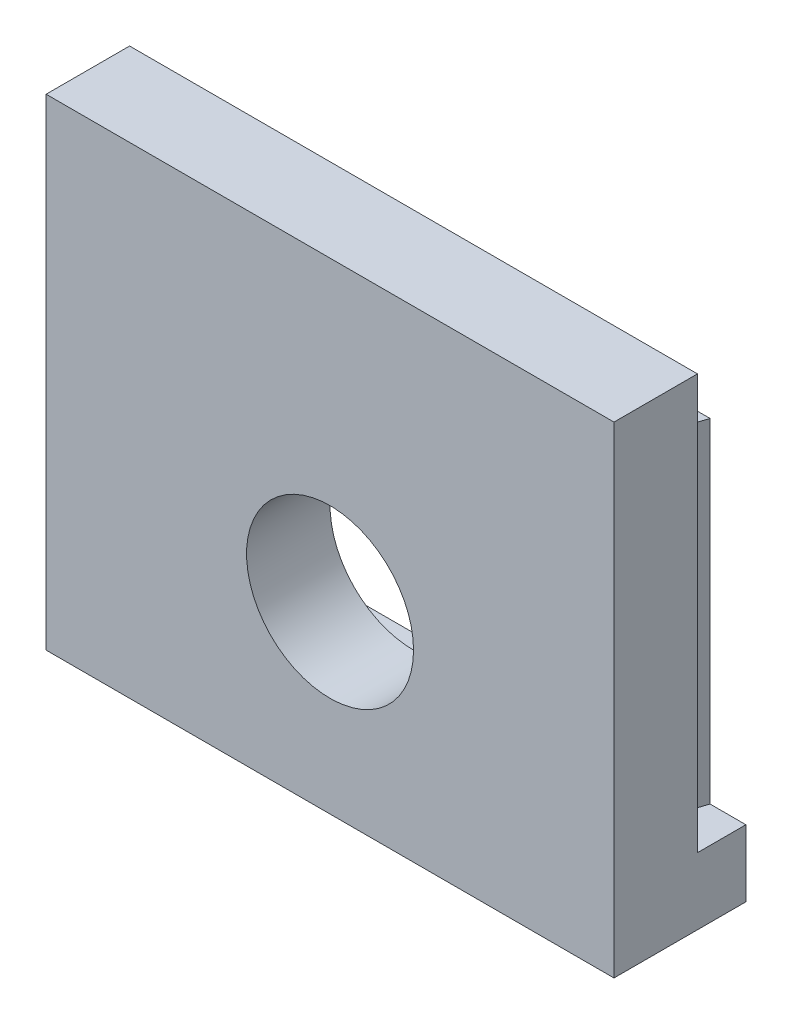
from build123d import *
from OCP.BRepFilletAPI import BRepFilletAPI_MakeChamfer

# Parameters (mm, degrees)
SKETCH_1_R          = 5
EXTRUDE_1_DEPTH     = 5
EXTRUDE_2_REACH     = 42.012
EXTRUDE_3_DEPTH     = 55
EXTRUDE_4_DEPTH     = 20
FILLET_1_R          = 10
CHAMFER_1_SIZE      = 1
CHAMFER_1_SIZE2     = 1.741048535
CHAMFER_1_SIZE2_2   = 3.661578825
CHAMFER_1_SIZE2_3   = 2.732050808
CUT_EXTRUDE_1_REACH = 86.876
SKETCH_5_R          = 1.65
SKETCH_6_R          = 54.70604167
CUT_EXTRUDE_2_DEPTH = 66.501221402
SKETCH_7_W          = 77.77608505
SKETCH_7_H          = 88.124851988
SKETCH_7_W_2        = 34.010032192
SKETCH_7_H_2        = 31.175862843
CUT_EXTRUDE_3_DEPTH = 41.477277576


with BuildPart() as part:
    # 草图1 → 凸台-拉伸1 (new body)
    with BuildSketch(Plane.XY):
        Polygon((-20, 26), (20, 26), (30, 0), (20, -26), (-20, -26), (-30, 0), align=None)
        with Locations((0, -15)):
            Circle(SKETCH_1_R, mode=Mode.SUBTRACT)
    extrude(amount=-EXTRUDE_1_DEPTH)

    # 凸台-拉伸2: up to this plane
    extrude_2_end = Plane(origin=(0, 24.665063509, -42.72114317), z_dir=(0, 0.499999999999998, -0.8660254037844398))
    # 草图2 → 凸台-拉伸2 (add, up to the surface)
    with BuildSketch(Plane(origin=(0, 0, -5), x_dir=(-1, 0, 0), z_dir=(0, 0, -1)), mode=Mode.PRIVATE) as extrude_2_sk1:
        Polygon((-20, 26), (20, 26), (21.923076923, 21), (-21.923076923, 21), align=None)
    extrude_2_tool1 = split(extrude(extrude_2_sk1.sketch, amount=EXTRUDE_2_REACH, mode=Mode.PRIVATE), bisect_by=extrude_2_end, keep=Keep.BOTH, mode=Mode.PRIVATE)
    add(extrude_2_tool1.solids().sort_by_distance((0, 23.461774, -5))[0])

    # 草图3 → 凸台-拉伸3 (add)
    with BuildSketch(Plane(origin=(0, 0, -5), x_dir=(-1, 0, 0), z_dir=(0, 0, -1))):
        Polygon((23.846153846, -16), (20, -26), (-20, -26), (-23.846153846, -16), (-19.560495915, -16), (-17.252803607, -22), (17.252803607, -22), (19.560495915, -16), align=None)
    extrude(amount=EXTRUDE_3_DEPTH)

    # 草图4 → 凸台-拉伸4 (add)
    with BuildSketch(Plane(origin=(0, -2, 0), x_dir=(1, 0, 0), z_dir=(0, 1, 0))):
        Polygon((11.105409255, 5), (10.138742589, 7.9), (14.861257411, 7.9), (13.894590745, 5), align=None)
        Polygon((-11.105409255, 5), (-13.894590745, 5), (-14.861257411, 7.9), (-10.138742589, 7.9), align=None)
    extrude(amount=-EXTRUDE_4_DEPTH)

    # 圆角1
    fillet_1_edges = [part.edges().sort_by_distance(p)[0] for p in [
        (-21.70332488, -16, -60),
        (21.70332488, -16, -5),
        (-21.70332488, -16, -5),
        (-20.961538462, 23.5, -43.393792901),
        (20.961538462, 23.5, -43.393792901),
    ]]
    fillet(fillet_1_edges, radius=FILLET_1_R - 0.0001)  # a hair under: the kernel refuses the full size

    # 倒角1: one chamfer whose edges measure the first distance from different faces: ONE call of the kernel's chamfer builder (chamfer() names one face for all edges)
    chamfer_1_edges_1 = [part.edges().sort_by_distance(p)[0] for p in [
        (20, 26, -16.238036635),
    ]]
    chamfer_1_side_1 = [part.faces().sort_by_distance(p)[0] for p in [
        (20.161601575, 25.579835904, -16.238036635),
    ]]
    chamfer_1_edges_2 = [part.edges().sort_by_distance(p)[0] for p in [
        (17.633378474, 26, -39.139308282),
        (-17.633378474, 26, -39.139308282),
    ]]
    chamfer_1_side_2 = [part.faces().sort_by_distance(p)[0] for p in [
        (0, 26, -20.586375743),
    ]]
    chamfer_1_edges_3 = [part.edges().sort_by_distance(p)[0] for p in [
        (0, 26, -41.950417228),
    ]]
    chamfer_1_side_3 = [part.faces().sort_by_distance(p)[0] for p in [
        (0, 26, -20.586375743),
    ]]
    chamfer_1_edges_4 = [part.edges().sort_by_distance(p)[0] for p in [
        (-20, 26, -16.238036635),
    ]]
    chamfer_1_side_4 = [part.faces().sort_by_distance(p)[0] for p in [
        (-21.761475348, 21.420164096, -20.181412308),
    ]]
    chamfer_1 = BRepFilletAPI_MakeChamfer(part.part.solid().wrapped)
    for e in chamfer_1_edges_1:
        chamfer_1.Add(CHAMFER_1_SIZE, CHAMFER_1_SIZE2, e.wrapped, chamfer_1_side_1[0].wrapped)  # the first distance lies on this face
    for e in chamfer_1_edges_2:
        chamfer_1.Add(CHAMFER_1_SIZE, CHAMFER_1_SIZE2_2, e.wrapped, chamfer_1_side_2[0].wrapped)  # the first distance lies on this face
    for e in chamfer_1_edges_3:
        chamfer_1.Add(CHAMFER_1_SIZE, CHAMFER_1_SIZE2_3, e.wrapped, chamfer_1_side_3[0].wrapped)  # the first distance lies on this face
    for e in chamfer_1_edges_4:
        chamfer_1.Add(CHAMFER_1_SIZE, CHAMFER_1_SIZE2, e.wrapped, chamfer_1_side_4[0].wrapped)  # the first distance lies on this face
    add(Compound.cast(chamfer_1.Shape()), mode=Mode.REPLACE)

    # 草图5 → 切除-拉伸1 (cut, up to next)
    with BuildSketch(Plane(origin=(0, 26, 0), x_dir=(1, 0, 0), z_dir=(0, 1, 0)), mode=Mode.PRIVATE) as cut_extrude_1_sk1:
        with Locations((14, 36)):
            Circle(SKETCH_5_R)
    cut_extrude_1_tool1 = extrude(cut_extrude_1_sk1.sketch, amount=-CUT_EXTRUDE_1_REACH, mode=Mode.PRIVATE) & part.part
    # 草图5 → 切除-拉伸1 (cut, up to next)
    with BuildSketch(Plane(origin=(0, 26, 0), x_dir=(1, 0, 0), z_dir=(0, 1, 0)), mode=Mode.PRIVATE) as cut_extrude_1_sk2:
        with Locations((14, 8)):
            Circle(SKETCH_5_R)
    cut_extrude_1_tool2 = extrude(cut_extrude_1_sk2.sketch, amount=-CUT_EXTRUDE_1_REACH, mode=Mode.PRIVATE) & part.part
    # 草图5 → 切除-拉伸1 (cut, up to next)
    with BuildSketch(Plane(origin=(0, 26, 0), x_dir=(1, 0, 0), z_dir=(0, 1, 0)), mode=Mode.PRIVATE) as cut_extrude_1_sk3:
        with Locations((-14, 8)):
            Circle(SKETCH_5_R)
    cut_extrude_1_tool3 = extrude(cut_extrude_1_sk3.sketch, amount=-CUT_EXTRUDE_1_REACH, mode=Mode.PRIVATE) & part.part
    # 草图5 → 切除-拉伸1 (cut, up to next)
    with BuildSketch(Plane(origin=(0, 26, 0), x_dir=(1, 0, 0), z_dir=(0, 1, 0)), mode=Mode.PRIVATE) as cut_extrude_1_sk4:
        with Locations((-14, 36)):
            Circle(SKETCH_5_R)
    cut_extrude_1_tool4 = extrude(cut_extrude_1_sk4.sketch, amount=-CUT_EXTRUDE_1_REACH, mode=Mode.PRIVATE) & part.part
    # 草图5 → 切除-拉伸1 (cut, up to next)
    with BuildSketch(Plane(origin=(0, 26, 0), x_dir=(1, 0, 0), z_dir=(0, 1, 0)), mode=Mode.PRIVATE) as cut_extrude_1_sk5:
        with Locations((10, 22)):
            Circle(SKETCH_5_R)
    cut_extrude_1_tool5 = extrude(cut_extrude_1_sk5.sketch, amount=-CUT_EXTRUDE_1_REACH, mode=Mode.PRIVATE) & part.part
    # 草图5 → 切除-拉伸1 (cut, up to next)
    with BuildSketch(Plane(origin=(0, 26, 0), x_dir=(1, 0, 0), z_dir=(0, 1, 0)), mode=Mode.PRIVATE) as cut_extrude_1_sk6:
        with Locations((-10, 22)):
            Circle(SKETCH_5_R)
    cut_extrude_1_tool6 = extrude(cut_extrude_1_sk6.sketch, amount=-CUT_EXTRUDE_1_REACH, mode=Mode.PRIVATE) & part.part
    # 草图5 → 切除-拉伸1 (cut, up to next)
    with BuildSketch(Plane(origin=(0, 26, 0), x_dir=(1, 0, 0), z_dir=(0, 1, 0)), mode=Mode.PRIVATE) as cut_extrude_1_sk7:
        with Locations((0, 12)):
            Circle(SKETCH_5_R)
    cut_extrude_1_tool7 = extrude(cut_extrude_1_sk7.sketch, amount=-CUT_EXTRUDE_1_REACH, mode=Mode.PRIVATE) & part.part
    # 草图5 → 切除-拉伸1 (cut, up to next)
    with BuildSketch(Plane(origin=(0, 26, 0), x_dir=(1, 0, 0), z_dir=(0, 1, 0)), mode=Mode.PRIVATE) as cut_extrude_1_sk8:
        with Locations((0, 32)):
            Circle(SKETCH_5_R)
    cut_extrude_1_tool8 = extrude(cut_extrude_1_sk8.sketch, amount=-CUT_EXTRUDE_1_REACH, mode=Mode.PRIVATE) & part.part
    add(cut_extrude_1_tool1.solids().sort_by_distance((14, 26, -36))[0], mode=Mode.SUBTRACT)
    add(cut_extrude_1_tool2.solids().sort_by_distance((14, 26, -8))[0], mode=Mode.SUBTRACT)
    add(cut_extrude_1_tool3.solids().sort_by_distance((-14, 26, -8))[0], mode=Mode.SUBTRACT)
    add(cut_extrude_1_tool4.solids().sort_by_distance((-14, 26, -36))[0], mode=Mode.SUBTRACT)
    add(cut_extrude_1_tool5.solids().sort_by_distance((10, 26, -22))[0], mode=Mode.SUBTRACT)
    add(cut_extrude_1_tool6.solids().sort_by_distance((-10, 26, -22))[0], mode=Mode.SUBTRACT)
    add(cut_extrude_1_tool7.solids().sort_by_distance((0, 26, -12))[0], mode=Mode.SUBTRACT)
    add(cut_extrude_1_tool8.solids().sort_by_distance((0, 26, -32))[0], mode=Mode.SUBTRACT)

    # 草图6 → 切除-拉伸2 (cut, through all)
    with BuildSketch(Plane(origin=(0, 0, -7.9), x_dir=(-1, 0, 0), z_dir=(0, 0, -1))):
        with Locations((0, -15)):
            Circle(SKETCH_6_R)
    extrude(amount=CUT_EXTRUDE_2_DEPTH, mode=Mode.SUBTRACT)

    # 草图7 → 切除-拉伸3 (cut, through all)
    with BuildSketch(Plane(origin=(0, 0, -7.9), x_dir=(-1, 0, 0), z_dir=(0, 0, -1))):
        with Locations((0, -12.753762072)):
            Rectangle(SKETCH_7_W, SKETCH_7_H)
        with Locations((0, -12.753762073)):
            Rectangle(SKETCH_7_W_2, SKETCH_7_H_2, mode=Mode.SUBTRACT)
    extrude(amount=-CUT_EXTRUDE_3_DEPTH, mode=Mode.SUBTRACT)


solid = part.part
